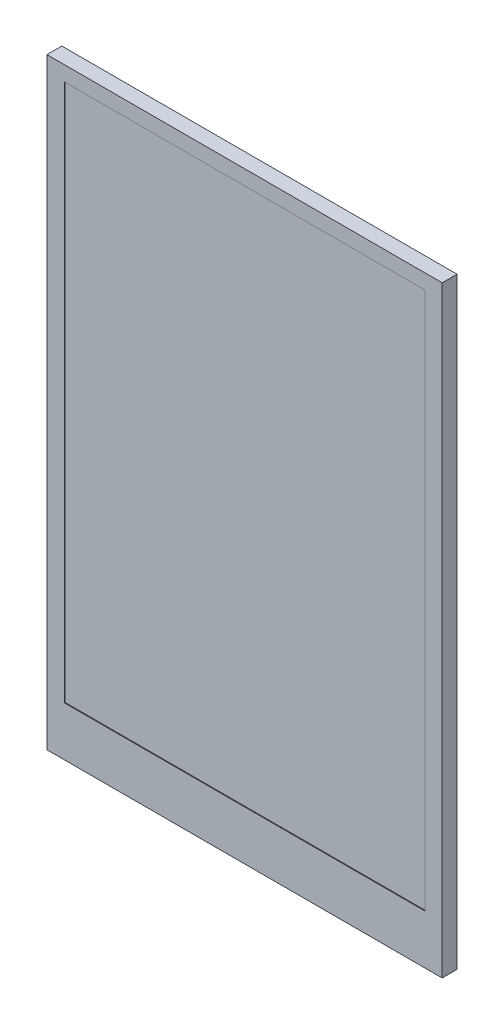
from build123d import *

# Parameters (mm, degrees)
SKETCH_1_W          = 54.46
SKETCH_1_H          = 82.94
EXTRUDE_1_DEPTH     = 2.05
SKETCH_2_W          = 49.66
SKETCH_2_H          = 74.09
CUT_EXTRUDE_1_DEPTH = 0.1
EXTRUDE_3_DEPTH     = 30
SKETCH_8_W          = 6.614912747
SKETCH_8_H          = 12.711315131
SKETCH_8_W_2        = 7.688185389
SKETCH_8_H_2        = 12.722203454
SKETCH_8_W_3        = 6.978944135
SKETCH_8_H_3        = 8.940227215
SKETCH_8_W_4        = 7.775121352
CUT_EXTRUDE_4_DEPTH = 30


with BuildPart() as part:
    # 草图1 → 凸台-拉伸1 (new body)
    with BuildSketch(Plane.XY):
        Rectangle(SKETCH_1_W, SKETCH_1_H)
    extrude(amount=EXTRUDE_1_DEPTH)

    # 草图2 → 切除-拉伸1 (cut)
    with BuildSketch(Plane.XY.offset(2.05)):
        with Locations((0, 2.375)):
            Rectangle(SKETCH_2_W, SKETCH_2_H)
    extrude(amount=-CUT_EXTRUDE_1_DEPTH, mode=Mode.SUBTRACT)


with BuildPart() as body_2:
    # 草图7 → 凸台-拉伸3 (new body)
    with BuildSketch(Plane(origin=(18, 0, 0), x_dir=(0, 0, -1), z_dir=(1, 0, 0))):
        with BuildLine():
            Line((2.788973153, -3.47), (3.081137547, -3.401882694))
            add(Edge.make_bspline(
                [(-1.286290223, -41.617402236), (-1.224095768, -41.727650245), (-1.089747709, -41.95194102), (-0.83112628, -42.329676644), (-0.503458585, -42.71461782), (-0.107187834, -43.036555713), (0.433676341, -43.294879884), (1.120204876, -43.264445379), (1.722278417, -42.792565347), (2.100104071, -42.122113497), (2.278942635, -41.347984014), (2.209612493, -40.570214173), (1.849059528, -39.674474817), (1.264727968, -38.712006756), (0.822080174, -37.51430565), (0.614471155, -36.295756427), (0.602295579, -34.616540519), (0.939611566, -32.431838606), (1.365977684, -30.167715909), (1.518386535, -28.319741091), (1.45080875, -26.465350772), (1.082311459, -24.198094667), (0.656984812, -21.560221519), (0.691842166, -19.078426593), (1.578364852, -16.664155066), (2.722467373, -14.166175984), (3.347976072, -11.480776575), (3.423931424, -9.215190181), (3.432868288, -7.447485447), (3.426853322, -6.126818404), (3.34268579, -4.794871008), (3.187138732, -3.856536201), (3.081137547, -3.401882694)],
                knots=[0, 0, 0, 0, 0.00390625, 0.0078125, 0.015625, 0.0234375, 0.03125, 0.046875, 0.0625, 0.078125, 0.09375, 0.109375, 0.125, 0.15625, 0.1875, 0.21875, 0.25, 0.3125, 0.375, 0.40625, 0.4375, 0.5, 0.5625, 0.625, 0.6875, 0.75, 0.8125, 0.875, 0.90625, 0.9375, 0.96875, 1, 1, 1, 1], degree=3))
            Line((-1.286290223, -41.617402236), (-1.025, -41.47))
            add(Edge.make_bspline(
                [(-1.025, -41.47), (0.586349998, -44.326333882), (2.724155137, -41.576940732), (1.167449335, -39.243135583), (-0.477429657, -35.136788863), (2.487468575, -28.274260613), (-0.832375717, -19.877821162), (3.082600613, -13.58725555), (3.137732964, -8.099185956), (3.133218415, -4.946514767), (2.788973153, -3.47)],
                knots=[0, 0, 0, 0, 0.100658936, 0.148689034, 0.189270544, 0.409602955, 0.622073036, 0.770561846, 0.898770933, 1, 1, 1, 1], degree=3))
        make_face()
    extrude(amount=-EXTRUDE_3_DEPTH)

    # 草图8 → 切除-拉伸4 (cut)
    with BuildSketch(Plane(origin=(0, 0, 0), x_dir=(-1, 0, 0), z_dir=(0, 0, -1))):
        with Locations((-14.692543627, -9.768428583)):
            Rectangle(SKETCH_8_W, SKETCH_8_H)
        with Locations((8.155907305, -9.762984421)):
            Rectangle(SKETCH_8_W_2, SKETCH_8_H_2)
        with Locations((8.510527933, -38.396276724)):
            Rectangle(SKETCH_8_W_3, SKETCH_8_H_3)
        with Locations((-14.112439324, -38.396276724)):
            Rectangle(SKETCH_8_W_4, SKETCH_8_H_3)
    extrude(amount=CUT_EXTRUDE_4_DEPTH, mode=Mode.SUBTRACT)


solid = Compound([part.part, body_2.part])
